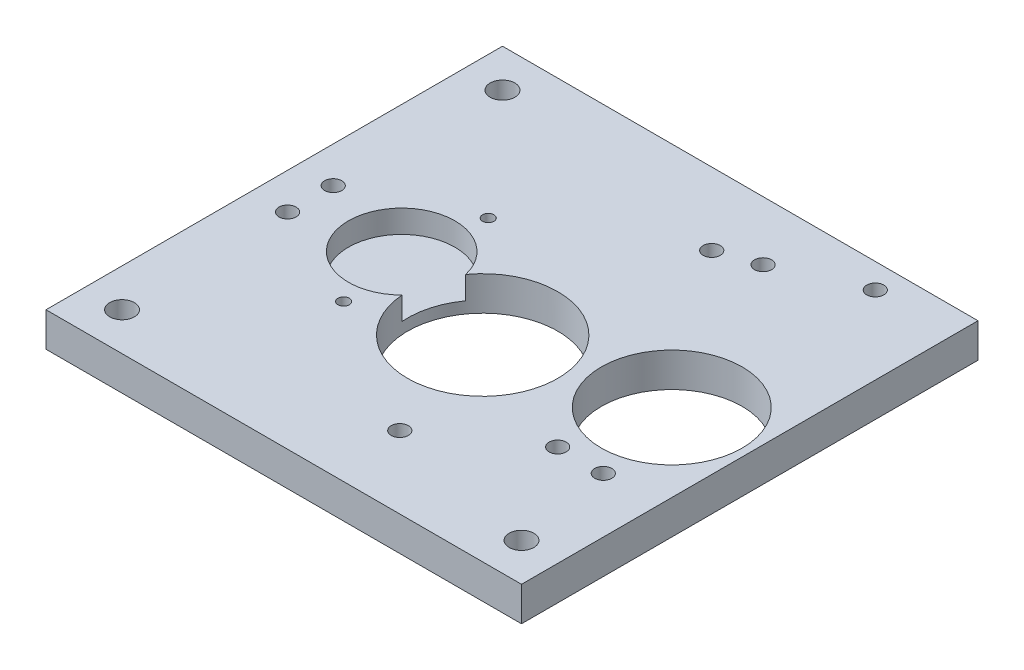
from build123d import *

# Parameters (mm, degrees)
SKETCH1_W                            = 125
SKETCH1_H                            = 120
TOP_BASE_DEPTH                       = 9
SKETCH5_R                            = 14
DRIVE_GEAR_EXTRUDE_CUT_DEPTH         = 6
SKETCH17_R                           = 19.75
INTERMEDIATE_GEAR_TOP_PART_CUT_DEPTH = 174.51080658
SKETCH8_R                            = 18.5
THUMB_EXTRUDE_CUT_DEPTH              = 174.51080658
SKETCH26_R                           = 1.5
STRING_HOLES_DEPTH                   = 174.51080658
THUMB_MOUNT_HOLES_R                  = 2.25
THUMB_MOUNT_HOLES_M4_DEPTH           = 174.51080658
FINGERS_MOUNT_HOLES_R                = 2.25
FINGERS_MOUNT_HOLES_M4_DEPTH         = 174.51080658
CONNECT_HOLES_POSITION_R             = 3.25
CONNECT_HOLES_M6_DEPTH               = 174.51080658
SKETCH27_R                           = 3.75
XL320_NUT_M4_DEPTH                   = 4


with BuildPart() as part:
    # Sketch1 → Top_Base (new body)
    with BuildSketch(Plane(origin=(0, 0, 0), x_dir=(1, 0, 0), z_dir=(0, 1, 0))):
        with Locations((62.5, 60)):
            Rectangle(SKETCH1_W, SKETCH1_H)
    extrude(amount=TOP_BASE_DEPTH)

    # Sketch5 → Drive_Gear_Extrude_Cut (cut)
    with BuildSketch(Plane(origin=(0, 9, 0), x_dir=(1, 0, 0), z_dir=(0, 1, 0))):
        with Locations((33.5, 60)):
            Circle(SKETCH5_R)
    extrude(amount=-DRIVE_GEAR_EXTRUDE_CUT_DEPTH, mode=Mode.SUBTRACT)

    # Sketch17 → Intermediate_Gear_Top_Part_Cut (cut, through all)
    with BuildSketch(Plane(origin=(0, 9, 0), x_dir=(1, 0, 0), z_dir=(0, 1, 0))):
        with Locations((63.146123438, 51.648511205)):
            Circle(SKETCH17_R)
    extrude(amount=-INTERMEDIATE_GEAR_TOP_PART_CUT_DEPTH, mode=Mode.SUBTRACT)

    # Sketch8 → Thumb_Extrude_Cut (cut, through all)
    with BuildSketch(Plane(origin=(0, 9, 0), x_dir=(1, 0, 0), z_dir=(0, 1, 0))):
        with Locations((104.5, 60)):
            Circle(SKETCH8_R)
    extrude(amount=-THUMB_EXTRUDE_CUT_DEPTH, mode=Mode.SUBTRACT)

    # Sketch26 → String_Holes (cut, through all)
    with BuildSketch(Plane.XZ):
        with Locations((37.25, -41)):
            Circle(SKETCH26_R)
        with Locations((37.25, -79)):
            Circle(SKETCH26_R)
    extrude(amount=-STRING_HOLES_DEPTH, mode=Mode.SUBTRACT)

    # Thumb_Mount_Holes → Thumb_Mount_Holes_(M4) (cut, through all)
    with BuildSketch(Plane(origin=(0, 9, 0), x_dir=(1, 0, 0), z_dir=(0, 1, 0))):
        with Locations((104.5, 113.5)):
            Circle(THUMB_MOUNT_HOLES_R)
        with Locations((84, 104.5)):
            Circle(THUMB_MOUNT_HOLES_R)
        with Locations((110.5, 36)):
            Circle(THUMB_MOUNT_HOLES_R)
        with Locations((98.5, 36)):
            Circle(THUMB_MOUNT_HOLES_R)
    extrude(amount=-THUMB_MOUNT_HOLES_M4_DEPTH, mode=Mode.SUBTRACT)

    # Fingers_Mount_Holes → Fingers_Mount_Holes_(M4) (cut, through all)
    with BuildSketch(Plane(origin=(0, 9, 0), x_dir=(1, 0, 0), z_dir=(0, 1, 0))):
        with Locations((74, 101)):
            Circle(FINGERS_MOUNT_HOLES_R)
        with Locations((74, 19)):
            Circle(FINGERS_MOUNT_HOLES_R)
        with Locations((9.5, 54)):
            Circle(FINGERS_MOUNT_HOLES_R)
        with Locations((9.5, 66)):
            Circle(FINGERS_MOUNT_HOLES_R)
    extrude(amount=-FINGERS_MOUNT_HOLES_M4_DEPTH, mode=Mode.SUBTRACT)

    # Connect_Holes_Position → Connect_Holes_(M6) (cut, through all)
    with BuildSketch(Plane(origin=(0, 9, 0), x_dir=(1, 0, 0), z_dir=(0, 1, 0))):
        with Locations((10, 110)):
            Circle(CONNECT_HOLES_POSITION_R)
        with Locations((115, 10)):
            Circle(CONNECT_HOLES_POSITION_R)
        with Locations((10, 10)):
            Circle(CONNECT_HOLES_POSITION_R)
    extrude(amount=-CONNECT_HOLES_M6_DEPTH, mode=Mode.SUBTRACT)

    # Sketch27 → XL320_Nut_(M4) (cut)
    with BuildSketch(Plane.XZ):
        with Locations((9.5, -66)):
            Circle(SKETCH27_R)
        with Locations((9.5, -54)):
            Circle(SKETCH27_R)
        with Locations((98.5, -36)):
            Circle(SKETCH27_R)
        with Locations((110.5, -36)):
            Circle(SKETCH27_R)
    extrude(amount=-XL320_NUT_M4_DEPTH, mode=Mode.SUBTRACT)


solid = part.part
